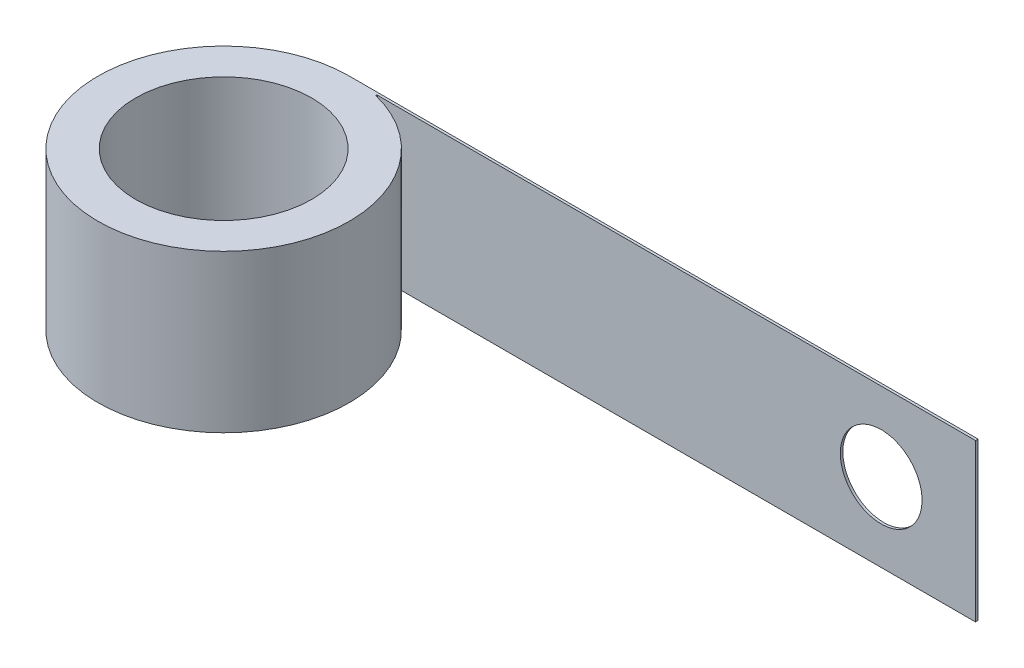
from build123d import *

# Parameters (mm, degrees)
SKETCH1_R           = 3.556
BOSS_EXTRUDE1_DEPTH = 6.35
SKETCH2_R           = 1.651
CUT_EXTRUDE1_DEPTH  = 6.35
FILLET1_R           = 0.0254


with BuildPart() as part:
    # Sketch1 → Boss-Extrude1 (new body)
    with BuildSketch(Plane(origin=(0, 0, 0), x_dir=(1, 0, 0), z_dir=(0, 1, 0))):
        with BuildLine():
            Line((0, 5.08), (25.4, 5.08))
            Line((25.4, 5.08), (25.4, 4.9784))
            Line((25.4, 4.9784), (1.010907236, 4.9784))
            ThreePointArc((1.010907236, 4.9784), (-0.508, -5.054536181), (0, 5.08))
        make_face()
        Circle(SKETCH1_R, mode=Mode.SUBTRACT)
    extrude(amount=BOSS_EXTRUDE1_DEPTH)

    # Sketch2 → Cut-Extrude1 (cut)
    with BuildSketch(Plane(origin=(0, 0, -5.08), x_dir=(-1, 0, 0), z_dir=(0, 0, -1))):
        with Locations((-21.59, 3.175)):
            Circle(SKETCH2_R)
    extrude(amount=-CUT_EXTRUDE1_DEPTH, mode=Mode.SUBTRACT)

    # Fillet1
    fillet1_edges = [part.edges().sort_by_distance(p)[0] for p in [
        (1.010907236, 3.175, -4.9784),
    ]]
    fillet(fillet1_edges, radius=FILLET1_R)


solid = part.part
